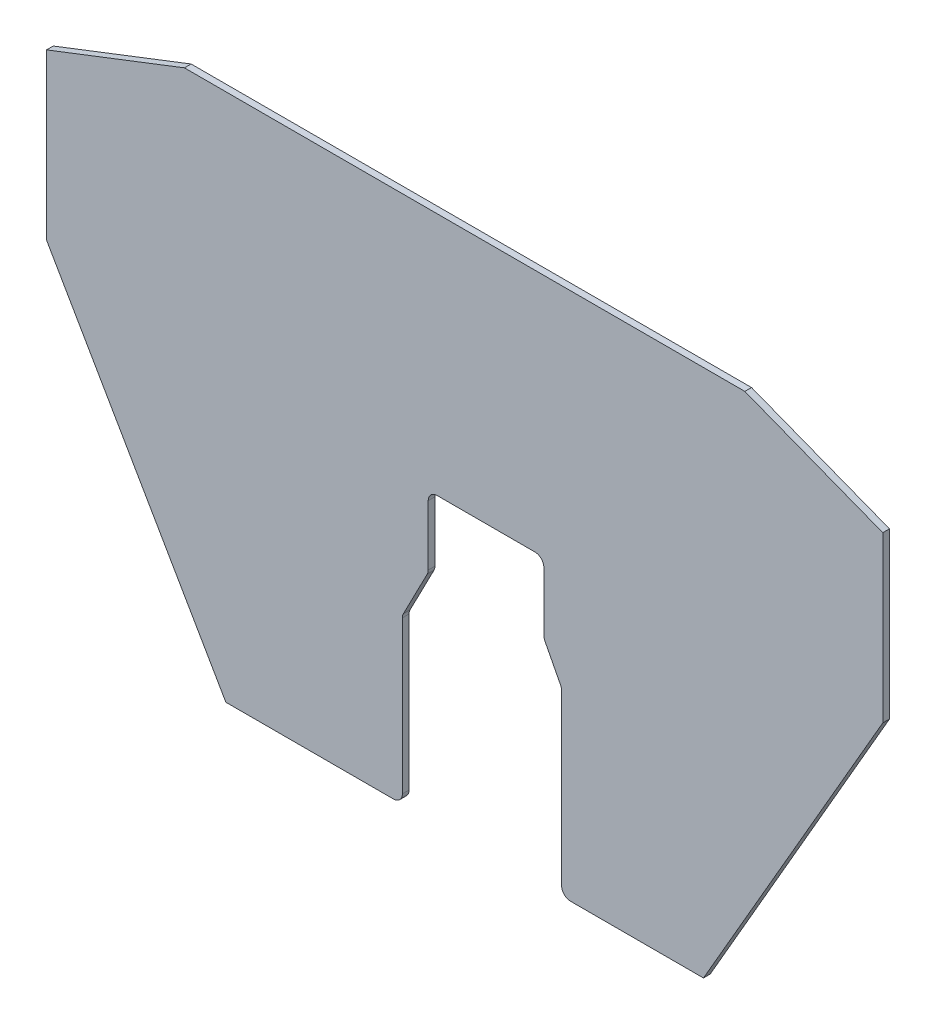
from build123d import *

# Parameters (mm, degrees)
BOSS_EXTRUDE1_DEPTH = 4.7752
FILLET1_R           = 6.35


with BuildPart() as part:
    # Sketch1 → Boss-Extrude1 (new body)
    with BuildSketch(Plane.XY):
        Polygon((170.467651581, -171.615744818), (69.239557334, -171.615744818), (69.239557334, -43.011155522), (56.539557334, -18.443630812), (56.539557334, 31.584255182), (50.8, 31.584255182), (-26.010442666, 31.584255182), (-26.010442666, -19.215744818), (-44.45, -54.886160601), (-44.45, -171.615744818), (-63.5, -171.615744818), (-170.467651581, -171.615744818), (-298.45, 50.056185115), (-298.45, 167.681366782), (-200.025, 205.781366782), (-63.5, 205.781366782), (63.5, 205.781366782), (200.025, 205.781366782), (298.45, 167.681366782), (298.45, 50.056185115), align=None)
    extrude(amount=BOSS_EXTRUDE1_DEPTH)

    # Fillet1
    fillet1_edges = [part.edges().sort_by_distance(p)[0] for p in [
        (-26.010442666, 31.584255182, 2.3876),
        (-26.010442666, -19.215744818, 2.3876),
        (-44.45, -54.886160601, 2.3876),
        (-44.45, -171.615744818, 2.3876),
        (69.239557334, -171.615744818, 2.3876),
        (69.239557334, -43.011155522, 2.3876),
        (56.539557334, -18.443630812, 2.3876),
        (56.539557334, 31.584255182, 2.3876),
    ]]
    fillet(fillet1_edges, radius=FILLET1_R)


solid = part.part
